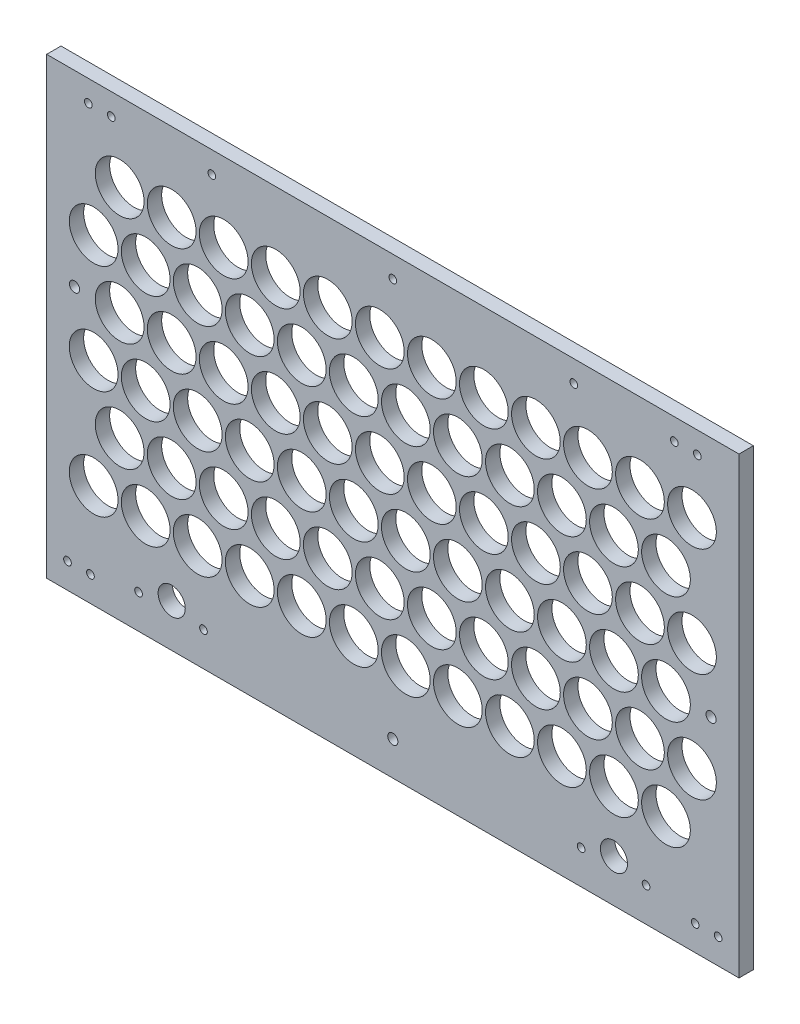
from build123d import *

# Parameters (mm, degrees)
SKETCH1_W                  = 306.05000007
SKETCH1_H                  = 197.4250001
BOSS_EXTRUDE1_DEPTH        = 6.35
CUT_EXTRUDE1_DEPTH         = 187.132543615
SKETCH4_R                  = 10.775
CUT_EXTRUDE2_DEPTH         = 187.132543615
LPATTERN1_COUNT            = 12
LPATTERN1_PITCH            = 23
LPATTERN2_COPY_1_DEPTH     = 187.132543615
LPATTERN2_COPY_2_DEPTH     = 187.132543615
LPATTERN2_COPY_3_DEPTH     = 187.132543615
LPATTERN2_COPY_4_DEPTH     = 187.132543615
LPATTERN2_COPY_5_DEPTH     = 187.132543615
LPATTERN2_COPY_6_DEPTH     = 187.132543615
LPATTERN2_COPY_7_DEPTH     = 187.132543615
LPATTERN2_COPY_8_DEPTH     = 187.132543615
LPATTERN2_COPY_9_DEPTH     = 187.132543615
LPATTERN2_COPY_10_DEPTH    = 187.132543615
LPATTERN2_COPY_11_DEPTH    = 187.132543615
LPATTERN2_COPY_12_DEPTH    = 187.132543615
LPATTERN2_COPY_13_DEPTH    = 187.132543615
LPATTERN2_COPY_14_DEPTH    = 187.132543615
LPATTERN2_COPY_15_DEPTH    = 187.132543615
LPATTERN2_COPY_16_DEPTH    = 187.132543615
LPATTERN2_COPY_17_DEPTH    = 187.132543615
LPATTERN2_COPY_18_DEPTH    = 187.132543615
LPATTERN2_COPY_19_DEPTH    = 187.132543615
LPATTERN2_COPY_20_DEPTH    = 187.132543615
LPATTERN2_COPY_21_DEPTH    = 187.132543615
LPATTERN2_COPY_22_DEPTH    = 187.132543615
LPATTERN2_COPY_23_SKETCH_R = 10.775
LPATTERN2_COPY_23_DEPTH    = 187.132543615
LPATTERN2_COPY_24_SKETCH_R = 10.775
LPATTERN2_COPY_24_DEPTH    = 187.132543615
LPATTERN2_COPY_25_SKETCH_R = 10.775
LPATTERN2_COPY_25_DEPTH    = 187.132543615
LPATTERN2_COPY_26_SKETCH_R = 10.775
LPATTERN2_COPY_26_DEPTH    = 187.132543615
LPATTERN2_COPY_27_SKETCH_R = 10.775
LPATTERN2_COPY_27_DEPTH    = 187.132543615
LPATTERN2_COPY_28_SKETCH_R = 10.775
LPATTERN2_COPY_28_DEPTH    = 187.132543615
LPATTERN2_COPY_29_SKETCH_R = 10.775
LPATTERN2_COPY_29_DEPTH    = 187.132543615
LPATTERN2_COPY_30_SKETCH_R = 10.775
LPATTERN2_COPY_30_DEPTH    = 187.132543615
LPATTERN2_COPY_31_SKETCH_R = 10.775
LPATTERN2_COPY_31_DEPTH    = 187.132543615
LPATTERN2_COPY_32_SKETCH_R = 10.775
LPATTERN2_COPY_32_DEPTH    = 187.132543615
LPATTERN2_COPY_33_SKETCH_R = 10.775
LPATTERN2_COPY_33_DEPTH    = 187.132543615
LPATTERN2_COPY_34_SKETCH_R = 10.775
LPATTERN2_COPY_34_DEPTH    = 187.132543615
LPATTERN2_COPY_35_SKETCH_R = 10.775
LPATTERN2_COPY_35_DEPTH    = 187.132543615
LPATTERN2_COPY_36_SKETCH_R = 10.775
LPATTERN2_COPY_36_DEPTH    = 187.132543615
LPATTERN2_COPY_37_SKETCH_R = 10.775
LPATTERN2_COPY_37_DEPTH    = 187.132543615
LPATTERN2_COPY_38_SKETCH_R = 10.775
LPATTERN2_COPY_38_DEPTH    = 187.132543615
LPATTERN2_COPY_39_SKETCH_R = 10.775
LPATTERN2_COPY_39_DEPTH    = 187.132543615
LPATTERN2_COPY_40_SKETCH_R = 10.775
LPATTERN2_COPY_40_DEPTH    = 187.132543615
LPATTERN2_COPY_41_SKETCH_R = 10.775
LPATTERN2_COPY_41_DEPTH    = 187.132543615
LPATTERN2_COPY_42_SKETCH_R = 10.775
LPATTERN2_COPY_42_DEPTH    = 187.132543615
LPATTERN2_COPY_43_SKETCH_R = 10.775
LPATTERN2_COPY_43_DEPTH    = 187.132543615
LPATTERN2_COPY_44_SKETCH_R = 10.775
LPATTERN2_COPY_44_DEPTH    = 187.132543615
LPATTERN2_COPY_45_DEPTH    = 187.132543615
LPATTERN2_COPY_46_DEPTH    = 187.132543615
LPATTERN2_COPY_47_SKETCH_R = 10.775
LPATTERN2_COPY_47_DEPTH    = 187.132543615
LPATTERN2_COPY_48_SKETCH_R = 10.775
LPATTERN2_COPY_48_DEPTH    = 187.132543615
SKETCH13_W                 = 306.05000007
SKETCH13_H                 = 6.35
BOSS_EXTRUDE2_DEPTH        = 3.175
SKETCH14_R                 = 6
CUT_EXTRUDE3_DEPTH         = 187.132543615
M3_CLEARANCE_HOLE1_D       = 3.4
SKETCH17_R                 = 2.25
CUT_EXTRUDE4_DEPTH         = 187.132543615


with BuildPart() as part:
    # Sketch1 → Boss-Extrude1 (new body)
    with BuildSketch(Plane.XY):
        with Locations((3.5e-08, -7.06250005)):
            Rectangle(SKETCH1_W, SKETCH1_H)
    extrude(amount=BOSS_EXTRUDE1_DEPTH)

    # Sketch3 → Cut-Extrude1 (cut, through all)
    with BuildSketch(Plane.XY.offset(6.35)):
        with BuildLine():
            ThreePointArc((-121.475, -60), (-132.24999993, -49.225), (-143.025, -59.999999859))
            ThreePointArc((-143.025, -59.999999859), (-139.869075617, -67.619075517), (-132.25, -70.775))
            ThreePointArc((-132.25, -70.775), (-124.630924433, -67.619075567), (-121.475, -60))
        make_face()
    cut_extrude1 = extrude(amount=-CUT_EXTRUDE1_DEPTH, mode=Mode.SUBTRACT)

    # Sketch4 → Cut-Extrude2 (cut, through all)
    with BuildSketch(Plane.XY.offset(6.35)):
        with Locations((-120.75, -36)):
            Circle(SKETCH4_R)
    cut_extrude2 = extrude(amount=-CUT_EXTRUDE2_DEPTH, mode=Mode.SUBTRACT)

    # LPattern1: Cut-Extrude1, Cut-Extrude2 ×12
    with Locations(*[(i * LPATTERN1_PITCH, 0, 0) for i in range(1, LPATTERN1_COUNT)]):
        add(cut_extrude1, mode=Mode.SUBTRACT)
        add(cut_extrude2, mode=Mode.SUBTRACT)

    # LPattern2 copy 1 sketch → LPattern2 copy 1 (cut, through all)
    with BuildSketch(Plane(origin=(23, 48, 6.35), x_dir=(1, 0, 0), z_dir=(0, 0, 1))):
        with BuildLine():
            ThreePointArc((-121.475, -60), (-132.24999993, -49.225), (-143.025, -59.999999859))
            ThreePointArc((-143.025, -59.999999859), (-139.869075617, -67.619075517), (-132.25, -70.775))
            ThreePointArc((-132.25, -70.775), (-124.630924433, -67.619075567), (-121.475, -60))
        make_face()
    extrude(amount=-LPATTERN2_COPY_1_DEPTH, mode=Mode.SUBTRACT)

    # LPattern2 copy 2 sketch → LPattern2 copy 2 (cut, through all)
    with BuildSketch(Plane(origin=(23, 96, 6.35), x_dir=(1, 0, 0), z_dir=(0, 0, 1))):
        with BuildLine():
            ThreePointArc((-121.475, -60), (-132.24999993, -49.225), (-143.025, -59.999999859))
            ThreePointArc((-143.025, -59.999999859), (-139.869075617, -67.619075517), (-132.25, -70.775))
            ThreePointArc((-132.25, -70.775), (-124.630924433, -67.619075567), (-121.475, -60))
        make_face()
    extrude(amount=-LPATTERN2_COPY_2_DEPTH, mode=Mode.SUBTRACT)

    # LPattern2 copy 3 sketch → LPattern2 copy 3 (cut, through all)
    with BuildSketch(Plane(origin=(46, 48, 6.35), x_dir=(1, 0, 0), z_dir=(0, 0, 1))):
        with BuildLine():
            ThreePointArc((-121.475, -60), (-132.24999993, -49.225), (-143.025, -59.999999859))
            ThreePointArc((-143.025, -59.999999859), (-139.869075617, -67.619075517), (-132.25, -70.775))
            ThreePointArc((-132.25, -70.775), (-124.630924433, -67.619075567), (-121.475, -60))
        make_face()
    extrude(amount=-LPATTERN2_COPY_3_DEPTH, mode=Mode.SUBTRACT)

    # LPattern2 copy 4 sketch → LPattern2 copy 4 (cut, through all)
    with BuildSketch(Plane(origin=(46, 96, 6.35), x_dir=(1, 0, 0), z_dir=(0, 0, 1))):
        with BuildLine():
            ThreePointArc((-121.475, -60), (-132.24999993, -49.225), (-143.025, -59.999999859))
            ThreePointArc((-143.025, -59.999999859), (-139.869075617, -67.619075517), (-132.25, -70.775))
            ThreePointArc((-132.25, -70.775), (-124.630924433, -67.619075567), (-121.475, -60))
        make_face()
    extrude(amount=-LPATTERN2_COPY_4_DEPTH, mode=Mode.SUBTRACT)

    # LPattern2 copy 5 sketch → LPattern2 copy 5 (cut, through all)
    with BuildSketch(Plane(origin=(69, 48, 6.35), x_dir=(1, 0, 0), z_dir=(0, 0, 1))):
        with BuildLine():
            ThreePointArc((-121.475, -60), (-132.24999993, -49.225), (-143.025, -59.999999859))
            ThreePointArc((-143.025, -59.999999859), (-139.869075617, -67.619075517), (-132.25, -70.775))
            ThreePointArc((-132.25, -70.775), (-124.630924433, -67.619075567), (-121.475, -60))
        make_face()
    extrude(amount=-LPATTERN2_COPY_5_DEPTH, mode=Mode.SUBTRACT)

    # LPattern2 copy 6 sketch → LPattern2 copy 6 (cut, through all)
    with BuildSketch(Plane(origin=(69, 96, 6.35), x_dir=(1, 0, 0), z_dir=(0, 0, 1))):
        with BuildLine():
            ThreePointArc((-121.475, -60), (-132.24999993, -49.225), (-143.025, -59.999999859))
            ThreePointArc((-143.025, -59.999999859), (-139.869075617, -67.619075517), (-132.25, -70.775))
            ThreePointArc((-132.25, -70.775), (-124.630924433, -67.619075567), (-121.475, -60))
        make_face()
    extrude(amount=-LPATTERN2_COPY_6_DEPTH, mode=Mode.SUBTRACT)

    # LPattern2 copy 7 sketch → LPattern2 copy 7 (cut, through all)
    with BuildSketch(Plane(origin=(92, 48, 6.35), x_dir=(1, 0, 0), z_dir=(0, 0, 1))):
        with BuildLine():
            ThreePointArc((-121.475, -60), (-132.24999993, -49.225), (-143.025, -59.999999859))
            ThreePointArc((-143.025, -59.999999859), (-139.869075617, -67.619075517), (-132.25, -70.775))
            ThreePointArc((-132.25, -70.775), (-124.630924433, -67.619075567), (-121.475, -60))
        make_face()
    extrude(amount=-LPATTERN2_COPY_7_DEPTH, mode=Mode.SUBTRACT)

    # LPattern2 copy 8 sketch → LPattern2 copy 8 (cut, through all)
    with BuildSketch(Plane(origin=(92, 96, 6.35), x_dir=(1, 0, 0), z_dir=(0, 0, 1))):
        with BuildLine():
            ThreePointArc((-121.475, -60), (-132.24999993, -49.225), (-143.025, -59.999999859))
            ThreePointArc((-143.025, -59.999999859), (-139.869075617, -67.619075517), (-132.25, -70.775))
            ThreePointArc((-132.25, -70.775), (-124.630924433, -67.619075567), (-121.475, -60))
        make_face()
    extrude(amount=-LPATTERN2_COPY_8_DEPTH, mode=Mode.SUBTRACT)

    # LPattern2 copy 9 sketch → LPattern2 copy 9 (cut, through all)
    with BuildSketch(Plane(origin=(115, 48, 6.35), x_dir=(1, 0, 0), z_dir=(0, 0, 1))):
        with BuildLine():
            ThreePointArc((-121.475, -60), (-132.24999993, -49.225), (-143.025, -59.999999859))
            ThreePointArc((-143.025, -59.999999859), (-139.869075617, -67.619075517), (-132.25, -70.775))
            ThreePointArc((-132.25, -70.775), (-124.630924433, -67.619075567), (-121.475, -60))
        make_face()
    extrude(amount=-LPATTERN2_COPY_9_DEPTH, mode=Mode.SUBTRACT)

    # LPattern2 copy 10 sketch → LPattern2 copy 10 (cut, through all)
    with BuildSketch(Plane(origin=(115, 96, 6.35), x_dir=(1, 0, 0), z_dir=(0, 0, 1))):
        with BuildLine():
            ThreePointArc((-121.475, -60), (-132.24999993, -49.225), (-143.025, -59.999999859))
            ThreePointArc((-143.025, -59.999999859), (-139.869075617, -67.619075517), (-132.25, -70.775))
            ThreePointArc((-132.25, -70.775), (-124.630924433, -67.619075567), (-121.475, -60))
        make_face()
    extrude(amount=-LPATTERN2_COPY_10_DEPTH, mode=Mode.SUBTRACT)

    # LPattern2 copy 11 sketch → LPattern2 copy 11 (cut, through all)
    with BuildSketch(Plane(origin=(138, 48, 6.35), x_dir=(1, 0, 0), z_dir=(0, 0, 1))):
        with BuildLine():
            ThreePointArc((-121.475, -60), (-132.24999993, -49.225), (-143.025, -59.999999859))
            ThreePointArc((-143.025, -59.999999859), (-139.869075617, -67.619075517), (-132.25, -70.775))
            ThreePointArc((-132.25, -70.775), (-124.630924433, -67.619075567), (-121.475, -60))
        make_face()
    extrude(amount=-LPATTERN2_COPY_11_DEPTH, mode=Mode.SUBTRACT)

    # LPattern2 copy 12 sketch → LPattern2 copy 12 (cut, through all)
    with BuildSketch(Plane(origin=(138, 96, 6.35), x_dir=(1, 0, 0), z_dir=(0, 0, 1))):
        with BuildLine():
            ThreePointArc((-121.475, -60), (-132.24999993, -49.225), (-143.025, -59.999999859))
            ThreePointArc((-143.025, -59.999999859), (-139.869075617, -67.619075517), (-132.25, -70.775))
            ThreePointArc((-132.25, -70.775), (-124.630924433, -67.619075567), (-121.475, -60))
        make_face()
    extrude(amount=-LPATTERN2_COPY_12_DEPTH, mode=Mode.SUBTRACT)

    # LPattern2 copy 13 sketch → LPattern2 copy 13 (cut, through all)
    with BuildSketch(Plane(origin=(161, 48, 6.35), x_dir=(1, 0, 0), z_dir=(0, 0, 1))):
        with BuildLine():
            ThreePointArc((-121.475, -60), (-132.24999993, -49.225), (-143.025, -59.999999859))
            ThreePointArc((-143.025, -59.999999859), (-139.869075617, -67.619075517), (-132.25, -70.775))
            ThreePointArc((-132.25, -70.775), (-124.630924433, -67.619075567), (-121.475, -60))
        make_face()
    extrude(amount=-LPATTERN2_COPY_13_DEPTH, mode=Mode.SUBTRACT)

    # LPattern2 copy 14 sketch → LPattern2 copy 14 (cut, through all)
    with BuildSketch(Plane(origin=(161, 96, 6.35), x_dir=(1, 0, 0), z_dir=(0, 0, 1))):
        with BuildLine():
            ThreePointArc((-121.475, -60), (-132.24999993, -49.225), (-143.025, -59.999999859))
            ThreePointArc((-143.025, -59.999999859), (-139.869075617, -67.619075517), (-132.25, -70.775))
            ThreePointArc((-132.25, -70.775), (-124.630924433, -67.619075567), (-121.475, -60))
        make_face()
    extrude(amount=-LPATTERN2_COPY_14_DEPTH, mode=Mode.SUBTRACT)

    # LPattern2 copy 15 sketch → LPattern2 copy 15 (cut, through all)
    with BuildSketch(Plane(origin=(184, 48, 6.35), x_dir=(1, 0, 0), z_dir=(0, 0, 1))):
        with BuildLine():
            ThreePointArc((-121.475, -60), (-132.24999993, -49.225), (-143.025, -59.999999859))
            ThreePointArc((-143.025, -59.999999859), (-139.869075617, -67.619075517), (-132.25, -70.775))
            ThreePointArc((-132.25, -70.775), (-124.630924433, -67.619075567), (-121.475, -60))
        make_face()
    extrude(amount=-LPATTERN2_COPY_15_DEPTH, mode=Mode.SUBTRACT)

    # LPattern2 copy 16 sketch → LPattern2 copy 16 (cut, through all)
    with BuildSketch(Plane(origin=(184, 96, 6.35), x_dir=(1, 0, 0), z_dir=(0, 0, 1))):
        with BuildLine():
            ThreePointArc((-121.475, -60), (-132.24999993, -49.225), (-143.025, -59.999999859))
            ThreePointArc((-143.025, -59.999999859), (-139.869075617, -67.619075517), (-132.25, -70.775))
            ThreePointArc((-132.25, -70.775), (-124.630924433, -67.619075567), (-121.475, -60))
        make_face()
    extrude(amount=-LPATTERN2_COPY_16_DEPTH, mode=Mode.SUBTRACT)

    # LPattern2 copy 17 sketch → LPattern2 copy 17 (cut, through all)
    with BuildSketch(Plane(origin=(207, 48, 6.35), x_dir=(1, 0, 0), z_dir=(0, 0, 1))):
        with BuildLine():
            ThreePointArc((-121.475, -60), (-132.24999993, -49.225), (-143.025, -59.999999859))
            ThreePointArc((-143.025, -59.999999859), (-139.869075617, -67.619075517), (-132.25, -70.775))
            ThreePointArc((-132.25, -70.775), (-124.630924433, -67.619075567), (-121.475, -60))
        make_face()
    extrude(amount=-LPATTERN2_COPY_17_DEPTH, mode=Mode.SUBTRACT)

    # LPattern2 copy 18 sketch → LPattern2 copy 18 (cut, through all)
    with BuildSketch(Plane(origin=(207, 96, 6.35), x_dir=(1, 0, 0), z_dir=(0, 0, 1))):
        with BuildLine():
            ThreePointArc((-121.475, -60), (-132.24999993, -49.225), (-143.025, -59.999999859))
            ThreePointArc((-143.025, -59.999999859), (-139.869075617, -67.619075517), (-132.25, -70.775))
            ThreePointArc((-132.25, -70.775), (-124.630924433, -67.619075567), (-121.475, -60))
        make_face()
    extrude(amount=-LPATTERN2_COPY_18_DEPTH, mode=Mode.SUBTRACT)

    # LPattern2 copy 19 sketch → LPattern2 copy 19 (cut, through all)
    with BuildSketch(Plane(origin=(230, 48, 6.35), x_dir=(1, 0, 0), z_dir=(0, 0, 1))):
        with BuildLine():
            ThreePointArc((-121.475, -60), (-132.24999993, -49.225), (-143.025, -59.999999859))
            ThreePointArc((-143.025, -59.999999859), (-139.869075617, -67.619075517), (-132.25, -70.775))
            ThreePointArc((-132.25, -70.775), (-124.630924433, -67.619075567), (-121.475, -60))
        make_face()
    extrude(amount=-LPATTERN2_COPY_19_DEPTH, mode=Mode.SUBTRACT)

    # LPattern2 copy 20 sketch → LPattern2 copy 20 (cut, through all)
    with BuildSketch(Plane(origin=(230, 96, 6.35), x_dir=(1, 0, 0), z_dir=(0, 0, 1))):
        with BuildLine():
            ThreePointArc((-121.475, -60), (-132.24999993, -49.225), (-143.025, -59.999999859))
            ThreePointArc((-143.025, -59.999999859), (-139.869075617, -67.619075517), (-132.25, -70.775))
            ThreePointArc((-132.25, -70.775), (-124.630924433, -67.619075567), (-121.475, -60))
        make_face()
    extrude(amount=-LPATTERN2_COPY_20_DEPTH, mode=Mode.SUBTRACT)

    # LPattern2 copy 21 sketch → LPattern2 copy 21 (cut, through all)
    with BuildSketch(Plane(origin=(253, 48, 6.35), x_dir=(1, 0, 0), z_dir=(0, 0, 1))):
        with BuildLine():
            ThreePointArc((-121.475, -60), (-132.24999993, -49.225), (-143.025, -59.999999859))
            ThreePointArc((-143.025, -59.999999859), (-139.869075617, -67.619075517), (-132.25, -70.775))
            ThreePointArc((-132.25, -70.775), (-124.630924433, -67.619075567), (-121.475, -60))
        make_face()
    extrude(amount=-LPATTERN2_COPY_21_DEPTH, mode=Mode.SUBTRACT)

    # LPattern2 copy 22 sketch → LPattern2 copy 22 (cut, through all)
    with BuildSketch(Plane(origin=(253, 96, 6.35), x_dir=(1, 0, 0), z_dir=(0, 0, 1))):
        with BuildLine():
            ThreePointArc((-121.475, -60), (-132.24999993, -49.225), (-143.025, -59.999999859))
            ThreePointArc((-143.025, -59.999999859), (-139.869075617, -67.619075517), (-132.25, -70.775))
            ThreePointArc((-132.25, -70.775), (-124.630924433, -67.619075567), (-121.475, -60))
        make_face()
    extrude(amount=-LPATTERN2_COPY_22_DEPTH, mode=Mode.SUBTRACT)

    # LPattern2 copy 23 sketch → LPattern2 copy 23 (cut, through all)
    with BuildSketch(Plane(origin=(23, 48, 6.35), x_dir=(1, 0, 0), z_dir=(0, 0, 1))):
        with Locations((-120.75, -36)):
            Circle(LPATTERN2_COPY_23_SKETCH_R)
    extrude(amount=-LPATTERN2_COPY_23_DEPTH, mode=Mode.SUBTRACT)

    # LPattern2 copy 24 sketch → LPattern2 copy 24 (cut, through all)
    with BuildSketch(Plane(origin=(23, 96, 6.35), x_dir=(1, 0, 0), z_dir=(0, 0, 1))):
        with Locations((-120.75, -36)):
            Circle(LPATTERN2_COPY_24_SKETCH_R)
    extrude(amount=-LPATTERN2_COPY_24_DEPTH, mode=Mode.SUBTRACT)

    # LPattern2 copy 25 sketch → LPattern2 copy 25 (cut, through all)
    with BuildSketch(Plane(origin=(46, 48, 6.35), x_dir=(1, 0, 0), z_dir=(0, 0, 1))):
        with Locations((-120.75, -36)):
            Circle(LPATTERN2_COPY_25_SKETCH_R)
    extrude(amount=-LPATTERN2_COPY_25_DEPTH, mode=Mode.SUBTRACT)

    # LPattern2 copy 26 sketch → LPattern2 copy 26 (cut, through all)
    with BuildSketch(Plane(origin=(46, 96, 6.35), x_dir=(1, 0, 0), z_dir=(0, 0, 1))):
        with Locations((-120.75, -36)):
            Circle(LPATTERN2_COPY_26_SKETCH_R)
    extrude(amount=-LPATTERN2_COPY_26_DEPTH, mode=Mode.SUBTRACT)

    # LPattern2 copy 27 sketch → LPattern2 copy 27 (cut, through all)
    with BuildSketch(Plane(origin=(69, 48, 6.35), x_dir=(1, 0, 0), z_dir=(0, 0, 1))):
        with Locations((-120.75, -36)):
            Circle(LPATTERN2_COPY_27_SKETCH_R)
    extrude(amount=-LPATTERN2_COPY_27_DEPTH, mode=Mode.SUBTRACT)

    # LPattern2 copy 28 sketch → LPattern2 copy 28 (cut, through all)
    with BuildSketch(Plane(origin=(69, 96, 6.35), x_dir=(1, 0, 0), z_dir=(0, 0, 1))):
        with Locations((-120.75, -36)):
            Circle(LPATTERN2_COPY_28_SKETCH_R)
    extrude(amount=-LPATTERN2_COPY_28_DEPTH, mode=Mode.SUBTRACT)

    # LPattern2 copy 29 sketch → LPattern2 copy 29 (cut, through all)
    with BuildSketch(Plane(origin=(92, 48, 6.35), x_dir=(1, 0, 0), z_dir=(0, 0, 1))):
        with Locations((-120.75, -36)):
            Circle(LPATTERN2_COPY_29_SKETCH_R)
    extrude(amount=-LPATTERN2_COPY_29_DEPTH, mode=Mode.SUBTRACT)

    # LPattern2 copy 30 sketch → LPattern2 copy 30 (cut, through all)
    with BuildSketch(Plane(origin=(92, 96, 6.35), x_dir=(1, 0, 0), z_dir=(0, 0, 1))):
        with Locations((-120.75, -36)):
            Circle(LPATTERN2_COPY_30_SKETCH_R)
    extrude(amount=-LPATTERN2_COPY_30_DEPTH, mode=Mode.SUBTRACT)

    # LPattern2 copy 31 sketch → LPattern2 copy 31 (cut, through all)
    with BuildSketch(Plane(origin=(115, 48, 6.35), x_dir=(1, 0, 0), z_dir=(0, 0, 1))):
        with Locations((-120.75, -36)):
            Circle(LPATTERN2_COPY_31_SKETCH_R)
    extrude(amount=-LPATTERN2_COPY_31_DEPTH, mode=Mode.SUBTRACT)

    # LPattern2 copy 32 sketch → LPattern2 copy 32 (cut, through all)
    with BuildSketch(Plane(origin=(115, 96, 6.35), x_dir=(1, 0, 0), z_dir=(0, 0, 1))):
        with Locations((-120.75, -36)):
            Circle(LPATTERN2_COPY_32_SKETCH_R)
    extrude(amount=-LPATTERN2_COPY_32_DEPTH, mode=Mode.SUBTRACT)

    # LPattern2 copy 33 sketch → LPattern2 copy 33 (cut, through all)
    with BuildSketch(Plane(origin=(138, 48, 6.35), x_dir=(1, 0, 0), z_dir=(0, 0, 1))):
        with Locations((-120.75, -36)):
            Circle(LPATTERN2_COPY_33_SKETCH_R)
    extrude(amount=-LPATTERN2_COPY_33_DEPTH, mode=Mode.SUBTRACT)

    # LPattern2 copy 34 sketch → LPattern2 copy 34 (cut, through all)
    with BuildSketch(Plane(origin=(138, 96, 6.35), x_dir=(1, 0, 0), z_dir=(0, 0, 1))):
        with Locations((-120.75, -36)):
            Circle(LPATTERN2_COPY_34_SKETCH_R)
    extrude(amount=-LPATTERN2_COPY_34_DEPTH, mode=Mode.SUBTRACT)

    # LPattern2 copy 35 sketch → LPattern2 copy 35 (cut, through all)
    with BuildSketch(Plane(origin=(161, 48, 6.35), x_dir=(1, 0, 0), z_dir=(0, 0, 1))):
        with Locations((-120.75, -36)):
            Circle(LPATTERN2_COPY_35_SKETCH_R)
    extrude(amount=-LPATTERN2_COPY_35_DEPTH, mode=Mode.SUBTRACT)

    # LPattern2 copy 36 sketch → LPattern2 copy 36 (cut, through all)
    with BuildSketch(Plane(origin=(161, 96, 6.35), x_dir=(1, 0, 0), z_dir=(0, 0, 1))):
        with Locations((-120.75, -36)):
            Circle(LPATTERN2_COPY_36_SKETCH_R)
    extrude(amount=-LPATTERN2_COPY_36_DEPTH, mode=Mode.SUBTRACT)

    # LPattern2 copy 37 sketch → LPattern2 copy 37 (cut, through all)
    with BuildSketch(Plane(origin=(184, 48, 6.35), x_dir=(1, 0, 0), z_dir=(0, 0, 1))):
        with Locations((-120.75, -36)):
            Circle(LPATTERN2_COPY_37_SKETCH_R)
    extrude(amount=-LPATTERN2_COPY_37_DEPTH, mode=Mode.SUBTRACT)

    # LPattern2 copy 38 sketch → LPattern2 copy 38 (cut, through all)
    with BuildSketch(Plane(origin=(184, 96, 6.35), x_dir=(1, 0, 0), z_dir=(0, 0, 1))):
        with Locations((-120.75, -36)):
            Circle(LPATTERN2_COPY_38_SKETCH_R)
    extrude(amount=-LPATTERN2_COPY_38_DEPTH, mode=Mode.SUBTRACT)

    # LPattern2 copy 39 sketch → LPattern2 copy 39 (cut, through all)
    with BuildSketch(Plane(origin=(207, 48, 6.35), x_dir=(1, 0, 0), z_dir=(0, 0, 1))):
        with Locations((-120.75, -36)):
            Circle(LPATTERN2_COPY_39_SKETCH_R)
    extrude(amount=-LPATTERN2_COPY_39_DEPTH, mode=Mode.SUBTRACT)

    # LPattern2 copy 40 sketch → LPattern2 copy 40 (cut, through all)
    with BuildSketch(Plane(origin=(207, 96, 6.35), x_dir=(1, 0, 0), z_dir=(0, 0, 1))):
        with Locations((-120.75, -36)):
            Circle(LPATTERN2_COPY_40_SKETCH_R)
    extrude(amount=-LPATTERN2_COPY_40_DEPTH, mode=Mode.SUBTRACT)

    # LPattern2 copy 41 sketch → LPattern2 copy 41 (cut, through all)
    with BuildSketch(Plane(origin=(230, 48, 6.35), x_dir=(1, 0, 0), z_dir=(0, 0, 1))):
        with Locations((-120.75, -36)):
            Circle(LPATTERN2_COPY_41_SKETCH_R)
    extrude(amount=-LPATTERN2_COPY_41_DEPTH, mode=Mode.SUBTRACT)

    # LPattern2 copy 42 sketch → LPattern2 copy 42 (cut, through all)
    with BuildSketch(Plane(origin=(230, 96, 6.35), x_dir=(1, 0, 0), z_dir=(0, 0, 1))):
        with Locations((-120.75, -36)):
            Circle(LPATTERN2_COPY_42_SKETCH_R)
    extrude(amount=-LPATTERN2_COPY_42_DEPTH, mode=Mode.SUBTRACT)

    # LPattern2 copy 43 sketch → LPattern2 copy 43 (cut, through all)
    with BuildSketch(Plane(origin=(253, 48, 6.35), x_dir=(1, 0, 0), z_dir=(0, 0, 1))):
        with Locations((-120.75, -36)):
            Circle(LPATTERN2_COPY_43_SKETCH_R)
    extrude(amount=-LPATTERN2_COPY_43_DEPTH, mode=Mode.SUBTRACT)

    # LPattern2 copy 44 sketch → LPattern2 copy 44 (cut, through all)
    with BuildSketch(Plane(origin=(253, 96, 6.35), x_dir=(1, 0, 0), z_dir=(0, 0, 1))):
        with Locations((-120.75, -36)):
            Circle(LPATTERN2_COPY_44_SKETCH_R)
    extrude(amount=-LPATTERN2_COPY_44_DEPTH, mode=Mode.SUBTRACT)

    # LPattern2 copy 45 sketch → LPattern2 copy 45 (cut, through all)
    with BuildSketch(Plane(origin=(0, 48, 6.35), x_dir=(1, 0, 0), z_dir=(0, 0, 1))):
        with BuildLine():
            ThreePointArc((-121.475, -60), (-132.24999993, -49.225), (-143.025, -59.999999859))
            ThreePointArc((-143.025, -59.999999859), (-139.869075617, -67.619075517), (-132.25, -70.775))
            ThreePointArc((-132.25, -70.775), (-124.630924433, -67.619075567), (-121.475, -60))
        make_face()
    extrude(amount=-LPATTERN2_COPY_45_DEPTH, mode=Mode.SUBTRACT)

    # LPattern2 copy 46 sketch → LPattern2 copy 46 (cut, through all)
    with BuildSketch(Plane(origin=(0, 96, 6.35), x_dir=(1, 0, 0), z_dir=(0, 0, 1))):
        with BuildLine():
            ThreePointArc((-121.475, -60), (-132.24999993, -49.225), (-143.025, -59.999999859))
            ThreePointArc((-143.025, -59.999999859), (-139.869075617, -67.619075517), (-132.25, -70.775))
            ThreePointArc((-132.25, -70.775), (-124.630924433, -67.619075567), (-121.475, -60))
        make_face()
    extrude(amount=-LPATTERN2_COPY_46_DEPTH, mode=Mode.SUBTRACT)

    # LPattern2 copy 47 sketch → LPattern2 copy 47 (cut, through all)
    with BuildSketch(Plane(origin=(0, 48, 6.35), x_dir=(1, 0, 0), z_dir=(0, 0, 1))):
        with Locations((-120.75, -36)):
            Circle(LPATTERN2_COPY_47_SKETCH_R)
    extrude(amount=-LPATTERN2_COPY_47_DEPTH, mode=Mode.SUBTRACT)

    # LPattern2 copy 48 sketch → LPattern2 copy 48 (cut, through all)
    with BuildSketch(Plane(origin=(0, 96, 6.35), x_dir=(1, 0, 0), z_dir=(0, 0, 1))):
        with Locations((-120.75, -36)):
            Circle(LPATTERN2_COPY_48_SKETCH_R)
    extrude(amount=-LPATTERN2_COPY_48_DEPTH, mode=Mode.SUBTRACT)

    # Sketch13 → Boss-Extrude2 (add)
    with BuildSketch(Plane(origin=(0, 91.65, 0), x_dir=(1, 0, 0), z_dir=(0, 1, 0))):
        with Locations((3.5e-08, -3.175)):
            Rectangle(SKETCH13_W, SKETCH13_H)
    extrude(amount=BOSS_EXTRUDE2_DEPTH)

    # Sketch14 → Cut-Extrude3 (cut, through all)
    with BuildSketch(Plane(origin=(0, 0, 0), x_dir=(-1, 0, 0), z_dir=(0, 0, -1))):
        with Locations((-97.75, -86.7750001)):
            Circle(SKETCH14_R)
    cut_extrude3 = extrude(amount=-CUT_EXTRUDE3_DEPTH, mode=Mode.SUBTRACT)

    # Mirror1: Cut-Extrude3 across plane
    add(cut_extrude3.mirror(Plane(origin=(0, 0, 0), x_dir=(0, 0, 1), z_dir=(1, 0, 0))), mode=Mode.SUBTRACT)

    # M3 Clearance Hole1 (through all)
    with Locations(Plane(origin=(0, 0, 0), x_dir=(-1, 0, 0), z_dir=(0, 0, -1))):
        with Locations((-111.94, -90.775), (-83.25, -90.775), (83.712, -90.775), (112.402, -90.775), (134.610000066, 85.3), (124.450000066, 85.3), (80, 85.3), (0, 85.3), (-80, 85.3), (-124.450000066, 85.3), (-134.610000066, 85.3), (143.817500066, -94.6000001), (133.657500066, -94.6000001), (-133.657500066, -94.6000001), (-143.817500066, -94.6000001)):
            Hole(M3_CLEARANCE_HOLE1_D / 2)

    # Sketch17 → Cut-Extrude4 (cut, through all)
    with BuildSketch(Plane(origin=(0, 0, 0), x_dir=(-1, 0, 0), z_dir=(0, 0, -1))):
        with Locations((0, -90.775)):
            Circle(SKETCH17_R)
        with Locations((140.687500033, 12)):
            Circle(SKETCH17_R)
        with Locations((-140.687500033, -12)):
            Circle(SKETCH17_R)
    extrude(amount=-CUT_EXTRUDE4_DEPTH, mode=Mode.SUBTRACT)


solid = part.part
